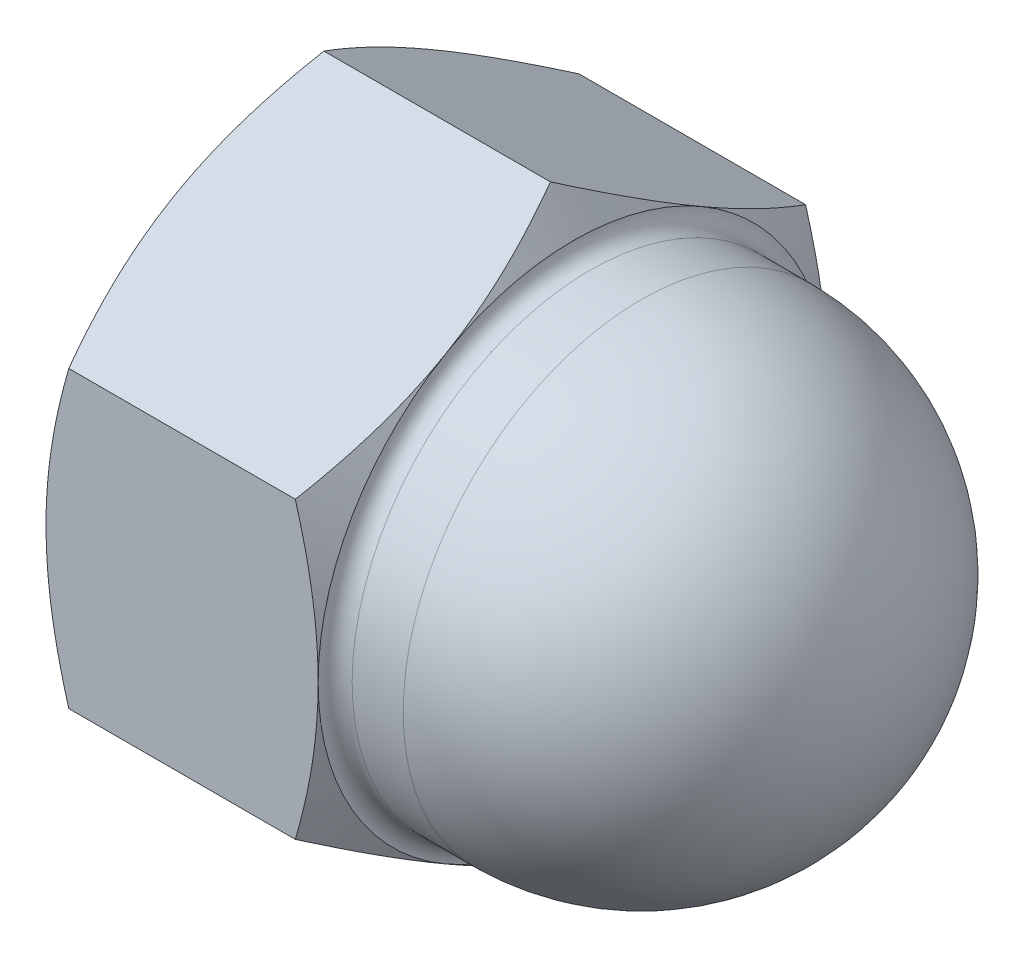
from build123d import *

# Parameters (mm, degrees)
BASENUT_DEPTH = 16
DOMEFILLET_R  = 1


with BuildPart() as part:
    # BaseNutSke → BaseNut (new body)
    with BuildSketch(Plane(origin=(0, 0, 0), x_dir=(0, 0, -1), z_dir=(1, 0, 0))):
        Polygon((15, 8.660254038), (15, -8.660254038), (0, -17.320508076), (-15, -8.660254038), (-15, 8.660254038), (0, 17.320508076), align=None)
    extrude(amount=BASENUT_DEPTH)

    # DomeSke → Dome (revolve)
    with BuildSketch(Plane.XY, mode=Mode.PRIVATE) as dome_sk:
        with BuildLine():
            Line((34, 0), (0, 0))
            Line((0, 0), (0, 14))
            Line((0, 14), (20, 14))
            ThreePointArc((20, 14), (29.899494937, 9.899494937), (34, 0))
        make_face()
    revolve(dome_sk.sketch.rotate(Axis((0, 0, 0), (1, 0, 0)), 90), axis=Axis((0, 0, 0), (1, 0, 0)))

    # Sketch4 → DoubleChamfer (revolve, cut)
    with BuildSketch(Plane.XY):
        Polygon((0, 15), (2.783121635, 19.820508076), (13.216878365, 19.820508076), (16, 15), (18, 15), (18, 30), (-2, 30), (-2, 15), align=None)
    revolve(axis=Axis((0, 0, 0), (1, 0, 0)), mode=Mode.SUBTRACT)

    # TapDriSke → TapDrill (revolve, cut)
    with BuildSketch(Plane.XY, mode=Mode.PRIVATE) as tapdrill_sk:
        Polygon((0, 8.75), (23, 8.75), (28.257530416, 0), (0, 0), align=None)
    revolve(tapdrill_sk.sketch.rotate(Axis((0, 0, 0), (1, 0, 0)), 90), axis=Axis((0, 0, 0), (1, 0, 0)), mode=Mode.SUBTRACT)

    # UcutSke → Undercut (revolve, cut)
    with BuildSketch(Plane.XY, mode=Mode.PRIVATE) as undercut_sk:
        Polygon((17.899422863, 10.1), (17.12, 8.75), (17.12, 0.25), (26.42, 0.25), (26.42, 10.1), align=None)
    revolve(undercut_sk.sketch.rotate(Axis((0, 0, 0), (1, 0, 0)), 90), axis=Axis((0, 0, 0), (1, 0, 0)), mode=Mode.SUBTRACT)

    # EndChamferSketch → EndChamfer (revolve, cut)
    with BuildSketch(Plane.XY):
        Polygon((-0.0254, 10), (0.0254, 10), (0.988185365, 8.625), (-0.0254, 8.625), align=None)
    revolve(axis=Axis((0, 0, 0), (-1, 0, 0)), mode=Mode.SUBTRACT)

    # DomeFillet
    domefillet_edges = [part.edges().sort_by_distance(p)[0] for p in [
        (16, 0, -14),
    ]]
    fillet(domefillet_edges, radius=DOMEFILLET_R - 0.0001)  # a hair under: the kernel refuses the full size


solid = part.part
